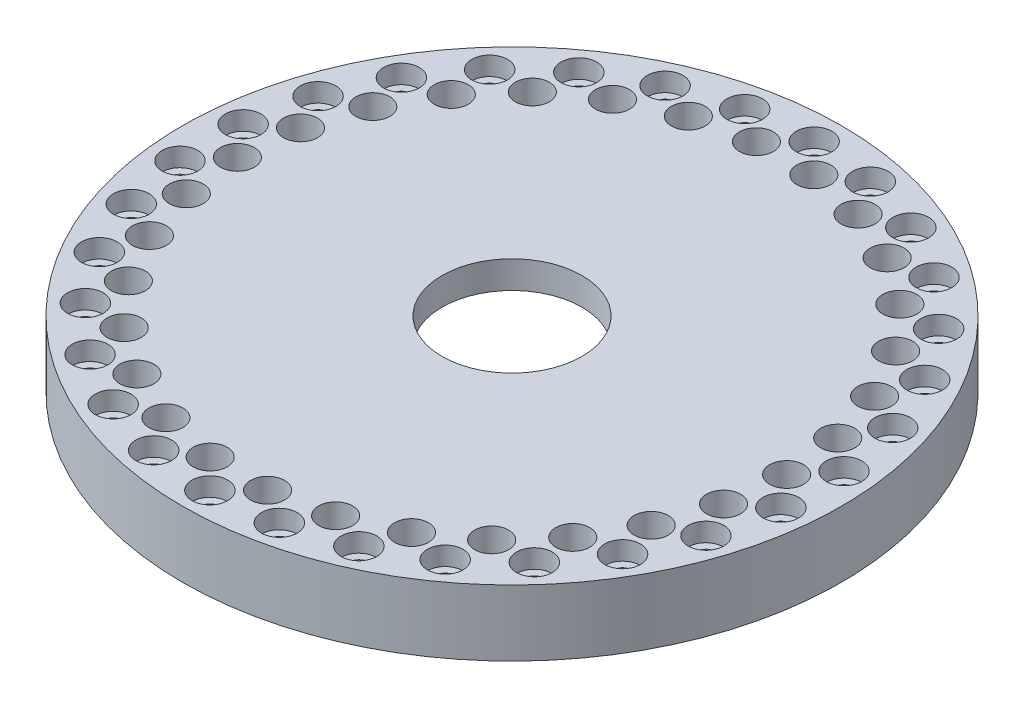
from build123d import *

# Parameters (mm, degrees)
SKETCH1_R                                           = 60
SKETCH1_R_2                                         = 12.75
BOSS_EXTRUDE1_DEPTH                                 = 12
CBORE_FOR_M3_HEX_SOCKET_HEAD_CAP_SCREW1_D           = 3.6
CBORE_FOR_M3_HEX_SOCKET_HEAD_CAP_SCREW1_CBORE_D     = 6.5
CBORE_FOR_M3_HEX_SOCKET_HEAD_CAP_SCREW1_CBORE_DEPTH = 3.4
F_6_2_6_2_DIAMETER_HOLE1_D                          = 6.2
SKETCH7_R                                           = 23.5
CUT_EXTRUDE1_DEPTH                                  = 7
BOSS_EXTRUDE2_START                                 = 0.6
SKETCH8_R                                           = 23.5
SKETCH8_R_2                                         = 21.5
BOSS_EXTRUDE2_DEPTH                                 = 0.6


with BuildPart() as part:
    # Sketch1 → Boss-Extrude1 (new body)
    with BuildSketch(Plane(origin=(0, 0, 0), x_dir=(1, 0, 0), z_dir=(0, 1, 0))):
        Circle(SKETCH1_R)
        Circle(SKETCH1_R_2, mode=Mode.SUBTRACT)
    extrude(amount=BOSS_EXTRUDE1_DEPTH)

    # CBORE for M3 Hex Socket Head Cap Screw1 (through all)
    with Locations(Plane(origin=(0, 12, 0), x_dir=(1, 0, 0), z_dir=(0, 1, 0))):
        with Locations((0, 55), (11.435142995, 53.79811804), (22.370515369, 50.24500017), (32.328188876, 44.495934691), (40.872965401, 36.80218335), (47.631397208, 27.5), (52.308108396, 16.995934691), (54.698704245, 5.74906548), (54.698704245, -5.74906548), (52.308108396, -16.995934691), (47.631397208, -27.5), (40.872965401, -36.80218335), (32.328188876, -44.495934691), (22.370515369, -50.24500017), (11.435142995, -53.79811804), (0, -55), (-11.435142995, -53.79811804), (-22.370515369, -50.24500017), (-32.328188876, -44.495934691), (-40.872965401, -36.80218335), (-47.631397208, -27.5), (-52.308108396, -16.995934691), (-54.698704245, -5.74906548), (-54.698704245, 5.74906548), (-52.308108396, 16.995934691), (-47.631397208, 27.5), (-40.872965401, 36.80218335), (-32.328188876, 44.495934691), (-22.370515369, 50.24500017), (-11.435142995, 53.79811804)):
            CounterBoreHole(CBORE_FOR_M3_HEX_SOCKET_HEAD_CAP_SCREW1_D / 2, CBORE_FOR_M3_HEX_SOCKET_HEAD_CAP_SCREW1_CBORE_D / 2, CBORE_FOR_M3_HEX_SOCKET_HEAD_CAP_SCREW1_CBORE_DEPTH)

    # Ø6.2 (6.2) Diameter Hole1 (through all)
    with Locations(Plane(origin=(0, 0, 0), x_dir=(-1, 0, 0), z_dir=(0, -1, 0))):
        with Locations((-15.450849719, 47.552825815), (-5.226423163, 49.726094768), (5.226423163, 49.726094768), (15.450849719, 47.552825815), (25, 43.301270189), (33.456530318, 37.157241274), (40.450849719, 29.389262615), (45.677272882, 20.336832154), (48.907380037, 10.395584541), (50, 0), (48.907380037, -10.395584541), (45.677272882, -20.336832154), (40.450849719, -29.389262615), (33.456530318, -37.157241274), (25, -43.301270189), (15.450849719, -47.552825815), (5.226423163, -49.726094768), (-5.226423163, -49.726094768), (-15.450849719, -47.552825815), (-25, -43.301270189), (-33.456530318, -37.157241274), (-40.450849719, -29.389262615), (-45.677272882, -20.336832154), (-48.907380037, -10.395584541), (-50, 0), (-48.907380037, 10.395584541), (-45.677272882, 20.336832154), (-40.450849719, 29.389262615), (-33.456530318, 37.157241274), (-25, 43.301270189)):
            Hole(F_6_2_6_2_DIAMETER_HOLE1_D / 2)

    # Sketch7 → Cut-Extrude1 (cut)
    with BuildSketch(Plane.XZ):
        Circle(SKETCH7_R)
    extrude(amount=-CUT_EXTRUDE1_DEPTH, mode=Mode.SUBTRACT)

    # Sketch8 → Boss-Extrude2 (add)
    with BuildSketch(Plane.XZ.offset(-7).offset(BOSS_EXTRUDE2_START)):
        Circle(SKETCH8_R)
        Circle(SKETCH8_R_2, mode=Mode.SUBTRACT)
    extrude(amount=-BOSS_EXTRUDE2_DEPTH)


solid = part.part
